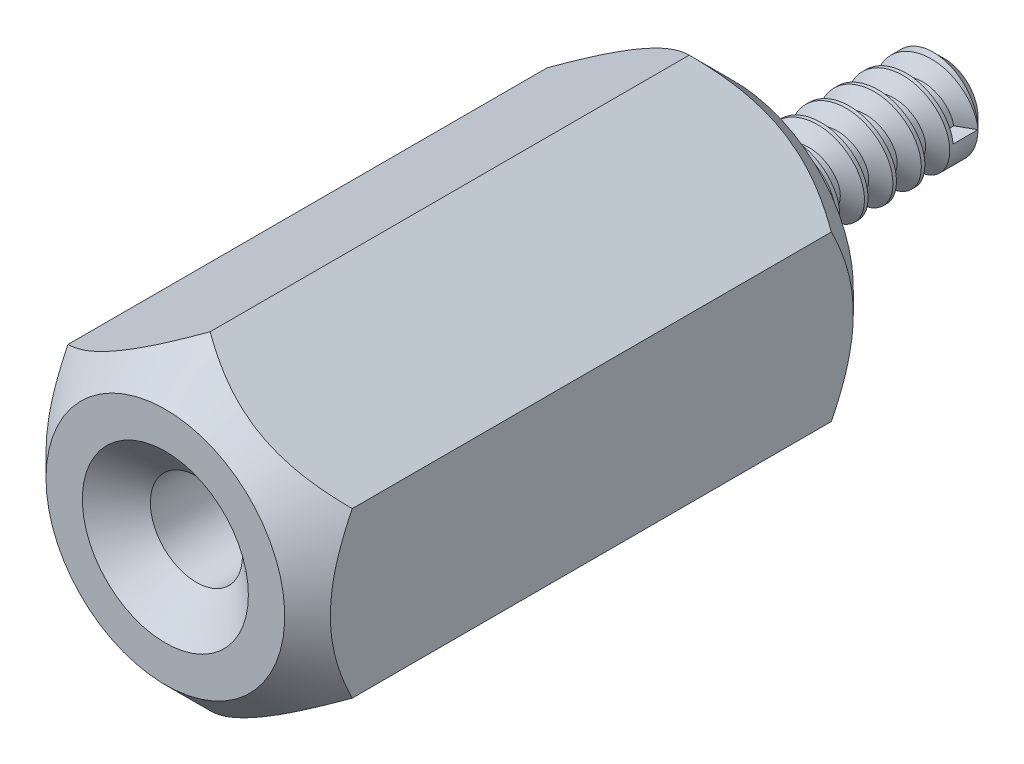
from build123d import *

# Parameters (mm, degrees)
BOSS_EXTRUDE1_DEPTH                               = 6.35
BOSS_EXTRUDE1_DEPTH_BACK                          = 6.35
CSK_FOR_1_FLAT_HEAD_MACHINE_SCREW_100_D           = 2.0574
CSK_FOR_1_FLAT_HEAD_MACHINE_SCREW_100_DEPTH       = 10
CSK_FOR_1_FLAT_HEAD_MACHINE_SCREW_100_CSINK_D     = 3.7084
CSK_FOR_1_FLAT_HEAD_MACHINE_SCREW_100_CSINK_ANGLE = 100
CSK_FOR_1_FLAT_HEAD_MACHINE_SCREW_100_TIP         = 0.618105319
SKETCH6_R                                         = 1
BOSS_EXTRUDE2_DEPTH                               = 4.7
CHAMFER1_SIZE                                     = 0.25
THREAD1_PITCH                                     = 0.635


with BuildPart() as part:
    # Sketch1 → Boss-Extrude1 (new, two sides: drawn at the far end of the back side and taken through both)
    with BuildSketch(Plane.XY.offset(-BOSS_EXTRUDE1_DEPTH_BACK)):
        Polygon((3.175, -1.833087105), (3.175, 1.833087105), (0, 3.666174209), (-3.175, 1.833087105), (-3.175, -1.833087105), (0, -3.666174209), align=None)
    extrude(amount=BOSS_EXTRUDE1_DEPTH + BOSS_EXTRUDE1_DEPTH_BACK)

    # Sketch3 → Cut-Revolve2 (revolve, cut)
    with BuildSketch(Plane(origin=(0, 0, 0), x_dir=(0, 0, -1), z_dir=(1, 0, 0)), mode=Mode.PRIVATE) as cut_revolve2_sk:
        Polygon((-5.35, 3.666174209), (-6.35, 2.666174209), (-6.35, 3.666174209), align=None)
    cut_revolve2 = revolve(cut_revolve2_sk.sketch.rotate(Axis((0, 0, -0.635), (0, 0, 1)), 90), axis=Axis((0, 0, -0.635), (0, 0, 1)), mode=Mode.SUBTRACT)

    # Mirror1: Cut-Revolve2 across plane
    add(cut_revolve2.mirror(Plane.XY), mode=Mode.SUBTRACT)

    # CSK for #1 Flat Head Machine Screw (100)1
    with Locations(Plane.XY.offset(6.35)):
        with Locations((0, 0)):
            CounterSinkHole(CSK_FOR_1_FLAT_HEAD_MACHINE_SCREW_100_D / 2, CSK_FOR_1_FLAT_HEAD_MACHINE_SCREW_100_CSINK_D / 2, depth=CSK_FOR_1_FLAT_HEAD_MACHINE_SCREW_100_DEPTH, counter_sink_angle=CSK_FOR_1_FLAT_HEAD_MACHINE_SCREW_100_CSINK_ANGLE)
            with Locations((0, 0, -(CSK_FOR_1_FLAT_HEAD_MACHINE_SCREW_100_DEPTH + CSK_FOR_1_FLAT_HEAD_MACHINE_SCREW_100_TIP / 2))):  # 118° drill point
                Cone(0, CSK_FOR_1_FLAT_HEAD_MACHINE_SCREW_100_D / 2, CSK_FOR_1_FLAT_HEAD_MACHINE_SCREW_100_TIP, mode=Mode.SUBTRACT)

    # Sketch6 → Boss-Extrude2 (add)
    with BuildSketch(Plane(origin=(0, 0, -6.35), x_dir=(-1, 0, 0), z_dir=(0, 0, -1))):
        Circle(SKETCH6_R)
    extrude(amount=BOSS_EXTRUDE2_DEPTH)

    # Chamfer1
    chamfer1_edges = [part.edges().sort_by_distance(p)[0] for p in [
        (1, 0, -11.05),
    ]]
    chamfer(chamfer1_edges, length=CHAMFER1_SIZE)

    # Thread1: the profile of Thread Profile1 profile screwed along a right-hand helix of 6.299213 turns, 6 arcs to a turn; built about Z, then put on its axis
    thread1_z = Axis((0, 0, 0), (0, 0, 1))
    thread1_corners = [(1.0003, 0, -0.000173205), (1.0003, 0, 0.555798203), (0.656296169, 0, 0.357187499), (0.656296169, 0, 0.198437499)]
    with BuildLine(mode=Mode.PRIVATE) as thread1_profile:
        Line(thread1_corners[0], thread1_corners[1])
        Line(thread1_corners[1], thread1_corners[2])
        Line(thread1_corners[2], thread1_corners[3])
        Line(thread1_corners[3], thread1_corners[0])
    thread1_cap = Face(thread1_profile.wire())
    thread1_turn_angles = [0, 30, 60, 90, 120, 150, 180, 210, 240, 270, 300, 330, 360]
    thread1_turn_weights = [1, 0.8660254037844387, 1, 0.8660254037844387, 1, 0.8660254037844387, 1, 0.8660254037844387, 1, 0.8660254037844387, 1, 0.8660254037844387, 1]
    thread1_turn_rails = [Edge.make_bspline([Vector(p[0], p[1], 0).rotate(thread1_z, thread1_turn_angles[k]) / thread1_turn_weights[k] + Vector(0, 0, p[2] + THREAD1_PITCH * thread1_turn_angles[k] / 360) for k in range(13)], [0, 0, 0, 1, 1, 2, 2, 3, 3, 4, 4, 5, 5, 6, 6, 6], 2, thread1_turn_weights) for p in thread1_corners]
    thread1_turn_sides = [Face.make_surface_from_curves(thread1_turn_rails[p[0]], thread1_turn_rails[p[1]]) for p in [(0, 1), (1, 2), (2, 3), (3, 0)]]
    thread1_last_angles = [2160, 2190, 2220, 2243.858267717, 2267.716535433]
    thread1_last_weights = [1, 0.8660254037844387, 1, 0.9145488039507501, 1]
    thread1_last_rails = [Edge.make_bspline([Vector(p[0], p[1], 0).rotate(thread1_z, thread1_last_angles[k]) / thread1_last_weights[k] + Vector(0, 0, p[2] + THREAD1_PITCH * thread1_last_angles[k] / 360) for k in range(5)], [0, 0, 0, 1, 1, 2, 2, 2], 2, thread1_last_weights) for p in thread1_corners]
    thread1_last_sides = [Face.make_surface_from_curves(thread1_last_rails[p[0]], thread1_last_rails[p[1]]) for p in [(0, 1), (1, 2), (2, 3), (3, 0)]]
    thread1 = Plane(origin=(0, 0, -10.8), x_dir=(1, 0, 0), z_dir=(0, 0, 1)) * Solid(Shell([*[p.moved(Location((0, 0, THREAD1_PITCH * i))) for i in range(6) for p in thread1_turn_sides], *thread1_last_sides, thread1_cap, thread1_cap.rotate(thread1_z, 2267.716535433).moved(Location((0, 0, THREAD1_PITCH * 2267.716535433 / 360)))]))
    add(thread1, mode=Mode.SUBTRACT)


solid = part.part
